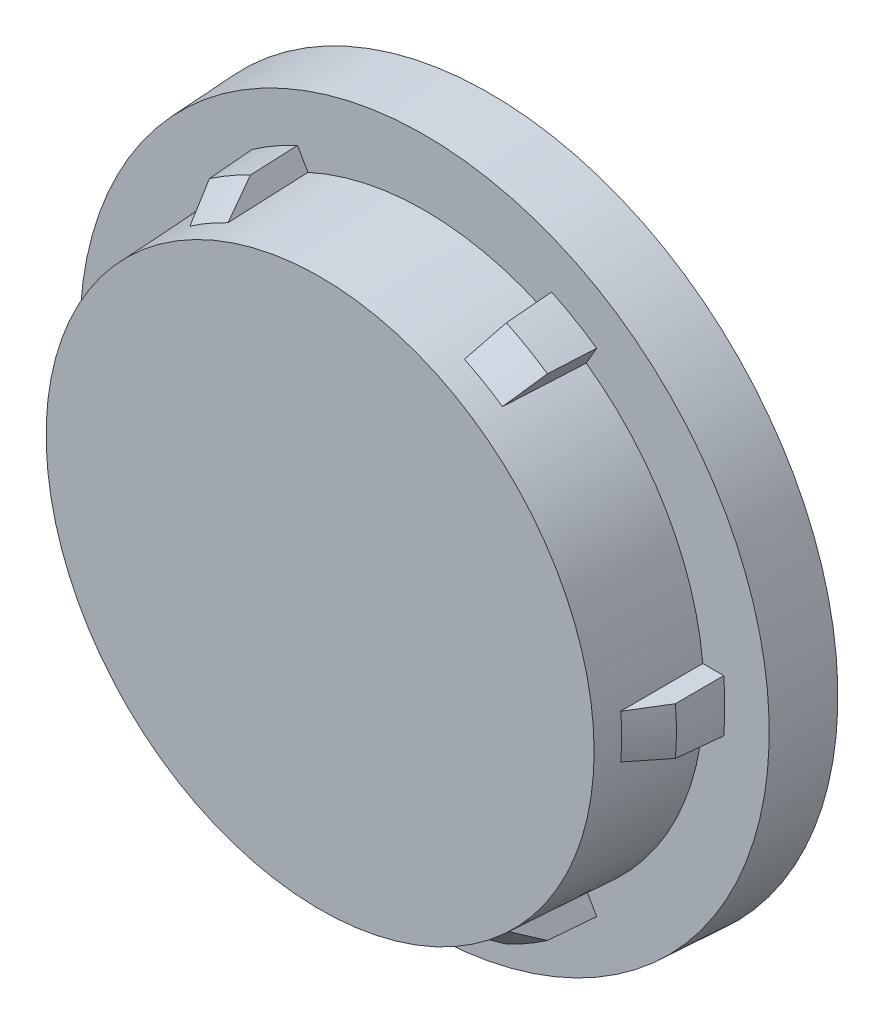
from build123d import *
from OCP.BRepFilletAPI import BRepFilletAPI_MakeChamfer

# Parameters (mm, degrees)
SKETCH1_R                                       = 5.25
BASE_EXTRUSION_DEPTH                            = 2
SKETCH3_R                                       = 6.5
LENS_MOUNTING_FLANGE_DEPTH                      = 1.25
SKETCH5_R                                       = 4.25
INNER_CAVITY_DEPTH                              = 2.25
OUTSIDE_DRAFT_ANGLE                             = 3
INSIDE_DRAFT_ANGLE                              = 3
INTERFERENCE_RIB_DEPTH                          = 1.5
INTERFERENCE_RIB_TAPER                          = 3
INTERFERENCE_RIB_CHAMFER_SIZE2                  = 0.4
INTERFERENCE_RIB_CHAMFER_SIZE                   = 0.618322148
INTERFERENCE_RIB_PATTREN_COUNT                  = 6
INTERFERENCE_RIB_CHAMFER_OF_INTERFERENCE_SIZE   = 0.4
INTERFERENCE_RIB_CHAMFER_OF_INTERFERENCE_SIZE_2 = 0.618322148


with BuildPart() as part:
    # Sketch1 → Base Extrusion (new body)
    with BuildSketch(Plane.XY):
        Circle(SKETCH1_R)
    extrude(amount=-BASE_EXTRUSION_DEPTH)

    # Sketch3 → Lens Mounting Flange (add)
    with BuildSketch(Plane(origin=(0, 0, -2), x_dir=(-1, 0, 0), z_dir=(0, 0, -1))):
        Circle(SKETCH3_R)
    extrude(amount=LENS_MOUNTING_FLANGE_DEPTH)

    # Sketch5 → Inner Cavity (cut)
    with BuildSketch(Plane(origin=(0, 0, -3.25), x_dir=(-1, 0, 0), z_dir=(0, 0, -1))):
        Circle(SKETCH5_R)
    extrude(amount=-INNER_CAVITY_DEPTH, mode=Mode.SUBTRACT)

    # Outside Draft
    outside_draft_faces = [part.faces().sort_by_distance(p)[0] for p in [
        (6.5, 0, -2.625),
        (-5.25, 0, -1),
    ]]
    draft(outside_draft_faces, Plane.XY, OUTSIDE_DRAFT_ANGLE)

    # Inside Draft
    inside_draft_faces = [part.faces().sort_by_distance(p)[0] for p in [
        (4.25, 0, -2.125),
    ]]
    draft(inside_draft_faces, Plane(origin=(0, 0, -1), x_dir=(-1, 0, 0), z_dir=(0, 0, -1)), INSIDE_DRAFT_ANGLE)

    # Sketch7 → Interference Rib (add)
    with BuildSketch(Plane.XY.offset(-2)):
        with BuildLine():
            ThreePointArc((-5.733053472, 0.5), (-5.754815559, 0), (-5.733053472, -0.5))
            Line((-5.733053472, -0.5), (-4.733053472, -0.5))
            Line((-4.733053472, -0.5), (-4.733053472, 0.5))
            Line((-4.733053472, 0.5), (-5.733053472, 0.5))
        make_face()
    interference_rib = extrude(amount=INTERFERENCE_RIB_DEPTH, taper=INTERFERENCE_RIB_TAPER)

    # Interference Rib Chamfer
    interference_rib_chamfer_edges = [part.edges().sort_by_distance(p)[0] for p in [
        (-5.67620389, 0, -0.5),
    ]]
    interference_rib_chamfer_side = [part.faces().sort_by_distance(p)[0] for p in [
        (-5.676622577, 0, -0.507989036),
    ]]
    chamfer(interference_rib_chamfer_edges, length=INTERFERENCE_RIB_CHAMFER_SIZE - 0.0001, length2=INTERFERENCE_RIB_CHAMFER_SIZE2 - 0.0001, reference=interference_rib_chamfer_side[0])  # a hair under: the kernel refuses the full size

    # Interference Rib Pattren: Interference Rib ×6 about axis
    interference_rib_pattren_axis = Axis((0, 0, 0), (0, 0, 1))
    for i in range(1, INTERFERENCE_RIB_PATTREN_COUNT):
        add(interference_rib.rotate(interference_rib_pattren_axis, i * 360 / INTERFERENCE_RIB_PATTREN_COUNT))

    # Interference Rib Chamfer of Interference
    interference_rib_chamfer_of_interference_edges_1 = [part.edges().sort_by_distance(p)[0] for p in [
        (-2.838101945, -4.915736765, -0.5),
    ]]
    interference_rib_chamfer_of_interference_side_1 = [part.faces().sort_by_distance(p)[0] for p in [
        (-2.834101945, -4.908808562, -0.5),
    ]]
    interference_rib_chamfer_of_interference_edges_2 = [part.edges().sort_by_distance(p)[0] for p in [
        (2.838101945, -4.915736765, -0.5),
    ]]
    interference_rib_chamfer_of_interference_side_2 = [part.faces().sort_by_distance(p)[0] for p in [
        (2.834101945, -4.908808562, -0.5),
    ]]
    interference_rib_chamfer_of_interference_edges_3 = [part.edges().sort_by_distance(p)[0] for p in [
        (5.67620389, 0, -0.5),
    ]]
    interference_rib_chamfer_of_interference_side_3 = [part.faces().sort_by_distance(p)[0] for p in [
        (5.66820389, 0, -0.5),
    ]]
    interference_rib_chamfer_of_interference_edges_4 = [part.edges().sort_by_distance(p)[0] for p in [
        (2.838101945, 4.915736765, -0.5),
    ]]
    interference_rib_chamfer_of_interference_side_4 = [part.faces().sort_by_distance(p)[0] for p in [
        (2.834101945, 4.908808562, -0.5),
    ]]
    interference_rib_chamfer_of_interference_edges_5 = [part.edges().sort_by_distance(p)[0] for p in [
        (-2.838101945, 4.915736765, -0.5),
    ]]
    interference_rib_chamfer_of_interference_side_5 = [part.faces().sort_by_distance(p)[0] for p in [
        (-2.834101945, 4.908808562, -0.5),
    ]]
    interference_rib_chamfer_of_interference = BRepFilletAPI_MakeChamfer(part.part.solid().wrapped)
    for e in interference_rib_chamfer_of_interference_edges_1:
        interference_rib_chamfer_of_interference.Add(INTERFERENCE_RIB_CHAMFER_OF_INTERFERENCE_SIZE - 0.0001, INTERFERENCE_RIB_CHAMFER_OF_INTERFERENCE_SIZE_2 - 0.0001, e.wrapped, interference_rib_chamfer_of_interference_side_1[0].wrapped)
    for e in interference_rib_chamfer_of_interference_edges_2:
        interference_rib_chamfer_of_interference.Add(INTERFERENCE_RIB_CHAMFER_OF_INTERFERENCE_SIZE - 0.0001, INTERFERENCE_RIB_CHAMFER_OF_INTERFERENCE_SIZE_2 - 0.0001, e.wrapped, interference_rib_chamfer_of_interference_side_2[0].wrapped)
    for e in interference_rib_chamfer_of_interference_edges_3:
        interference_rib_chamfer_of_interference.Add(INTERFERENCE_RIB_CHAMFER_OF_INTERFERENCE_SIZE - 0.0001, INTERFERENCE_RIB_CHAMFER_OF_INTERFERENCE_SIZE_2 - 0.0001, e.wrapped, interference_rib_chamfer_of_interference_side_3[0].wrapped)
    for e in interference_rib_chamfer_of_interference_edges_4:
        interference_rib_chamfer_of_interference.Add(INTERFERENCE_RIB_CHAMFER_OF_INTERFERENCE_SIZE - 0.0001, INTERFERENCE_RIB_CHAMFER_OF_INTERFERENCE_SIZE_2 - 0.0001, e.wrapped, interference_rib_chamfer_of_interference_side_4[0].wrapped)
    for e in interference_rib_chamfer_of_interference_edges_5:
        interference_rib_chamfer_of_interference.Add(INTERFERENCE_RIB_CHAMFER_OF_INTERFERENCE_SIZE - 0.0001, INTERFERENCE_RIB_CHAMFER_OF_INTERFERENCE_SIZE_2 - 0.0001, e.wrapped, interference_rib_chamfer_of_interference_side_5[0].wrapped)
    add(Compound.cast(interference_rib_chamfer_of_interference.Shape()), mode=Mode.REPLACE)  # a hair under: the kernel refuses the full size


solid = part.part
